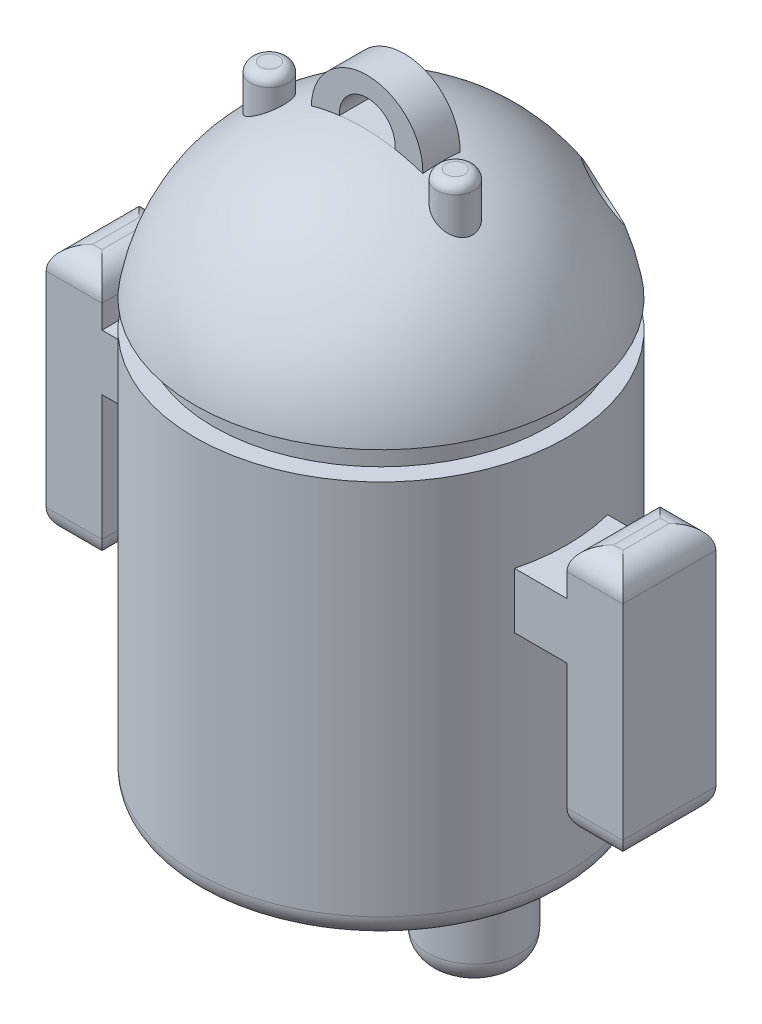
from build123d import *

# Parameters (mm, degrees)
CROQUIS2_R               = 3
CORTAR_EXTRUIR1_DEPTH    = 70.057946682
CROQUIS9_R               = 2
SALIENTE_EXTRUIR4_DEPTH  = 64
CROQUIS12_R              = 5
SALIENTE_EXTRUIR7_DEPTH  = 10
SALIENTE_EXTRUIR8_DEPTH  = 5
CROQUIS18_R              = 6
SALIENTE_EXTRUIR10_DEPTH = 2
CORTAR_EXTRUIR7_DEPTH    = 4
REDONDEO7_R              = 1
REDONDEO8_R              = 2.5
REDONDEO9_R              = 2.5
REDONDEO10_R             = 2.5
REDONDEO13_R             = 2.5


with BuildPart() as part:
    # Croquis1 → Revolución1 (revolve)
    with BuildSketch(Plane.XY):
        with BuildLine():
            Line((0, 63), (0, 0))
            Line((0, 0), (20, 0))
            Line((20, 0), (20, 43))
            Line((20, 43), (18, 43))
            Line((18, 43), (18, 46))
            Line((18, 46), (20, 46))
            ThreePointArc((20, 46), (13.124404748, 58.175770292), (0, 63))
        make_face()
    revolve(axis=Axis((0, 63, 0), (0, -1, 0)))

    # Croquis2 → Cortar-Extruir1 (cut, through all)
    with BuildSketch(Plane.XY):
        with Locations((-8, 52)):
            Circle(CROQUIS2_R)
        with Locations((8, 52)):
            Circle(CROQUIS2_R)
    extrude(amount=-CORTAR_EXTRUIR1_DEPTH, mode=Mode.SUBTRACT)

    # Croquis9 → Saliente-Extruir4 (add)
    with BuildSketch(Plane(origin=(0, 0, 0), x_dir=(1, 0, 0), z_dir=(0, 1, 0))):
        with Locations((-10, -2)):
            Circle(CROQUIS9_R)
    saliente_extruir4 = extrude(amount=SALIENTE_EXTRUIR4_DEPTH)

    # Croquis12 → Saliente-Extruir7 (add)
    with BuildSketch(Plane(origin=(0, 0, 0), x_dir=(1, 0, 0), z_dir=(0, 1, 0))):
        with Locations((-10, 0)):
            Circle(CROQUIS12_R)
    saliente_extruir7 = extrude(amount=-SALIENTE_EXTRUIR7_DEPTH)

    # Croquis17 → Saliente-Extruir8 (add, symmetric)
    with BuildSketch(Plane.XY):
        Polygon((-5, 27), (-5, 33), (-25, 33), (-25, 38), (-31, 38), (-31, 11), (-25, 11), (-25, 27), align=None)
    saliente_extruir8 = extrude(amount=SALIENTE_EXTRUIR8_DEPTH, both=True)

    # Simetría4: Saliente-Extruir4, Saliente-Extruir7, Saliente-Extruir8 across plane
    add(saliente_extruir4.mirror(Plane(origin=(0, 0, 0), x_dir=(0, 0, 1), z_dir=(1, 0, 0))))
    add(saliente_extruir7.mirror(Plane(origin=(0, 0, 0), x_dir=(0, 0, 1), z_dir=(1, 0, 0))))
    add(saliente_extruir8.mirror(Plane(origin=(0, 0, 0), x_dir=(0, 0, 1), z_dir=(1, 0, 0))))

    # Croquis18 → Saliente-Extruir10 (add, symmetric)
    with BuildSketch(Plane.XY):
        with Locations((0.5, 62)):
            Circle(CROQUIS18_R)
    extrude(amount=SALIENTE_EXTRUIR10_DEPTH, both=True)

    # Croquis20 → Cortar-Extruir7 (cut)
    with BuildSketch(Plane(origin=(0, 0, -2), x_dir=(-1, 0, 0), z_dir=(0, 0, -1))):
        with BuildLine():
            ThreePointArc((-3.508102494, 62.593580081), (-0.52321022, 62.894276125), (2.473261535, 62.74882159))
            ThreePointArc((2.473261535, 62.74882159), (-0.601046604, 65.893266204), (-3.508102494, 62.593580081))
        make_face()
    extrude(amount=-CORTAR_EXTRUIR7_DEPTH, mode=Mode.SUBTRACT)

    # Redondeo7
    redondeo7_edges = [part.edges().sort_by_distance(p)[0] for p in [
        (-12, 64, 2),
        (12, 64, 2),
    ]]
    fillet(redondeo7_edges, radius=REDONDEO7_R)

    # Redondeo8
    redondeo8_edges = [part.edges().sort_by_distance(p)[0] for p in [
        (-15, -10, 0),
        (15, -10, 0),
    ]]
    fillet(redondeo8_edges, radius=REDONDEO8_R)

    # Redondeo9
    redondeo9_edges = [part.edges().sort_by_distance(p)[0] for p in [
        (-31, 11, 0),
        (-28, 11, 5),
        (-25, 11, 0),
        (-28, 11, -5),
        (25, 11, 0),
        (28, 11, 5),
        (31, 11, 0),
        (28, 11, -5),
    ]]
    fillet(redondeo9_edges, radius=REDONDEO9_R)

    # Redondeo10
    redondeo10_edges = [part.edges().sort_by_distance(p)[0] for p in [
        (-25, 38, 0),
        (-28, 38, 5),
        (-31, 38, 0),
        (-28, 38, -5),
        (31, 38, 0),
        (28, 38, 5),
        (25, 38, 0),
        (28, 38, -5),
    ]]
    fillet(redondeo10_edges, radius=REDONDEO10_R)

    # Redondeo13
    redondeo13_edges = [part.edges().sort_by_distance(p)[0] for p in [
        (-20, 0, 0),
    ]]
    fillet(redondeo13_edges, radius=REDONDEO13_R)


solid = part.part
